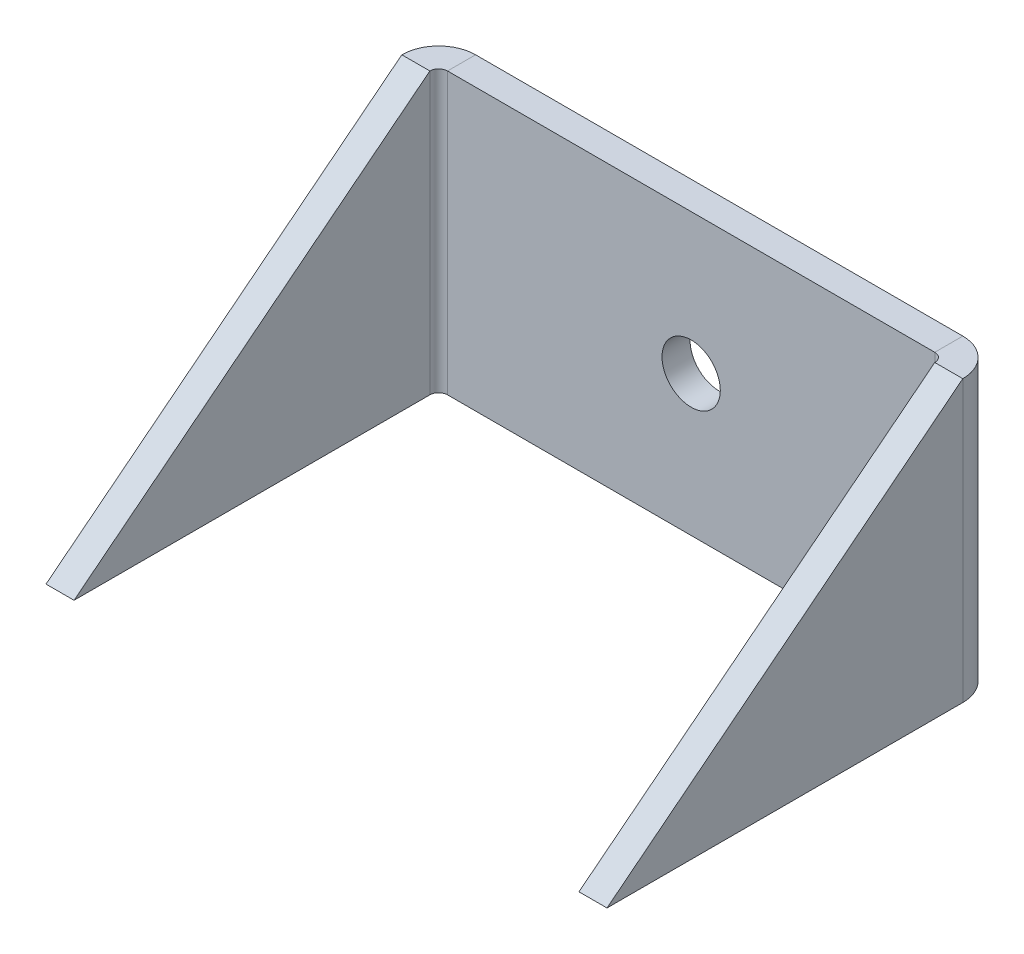
from build123d import *

# Parameters (mm, degrees)
SKETCH2_W                    = 57.15
SKETCH2_H                    = 31.75
BASE_FLANGE1_DEPTH           = 3.175
EDGE_FLANGE1_STRIP_W         = 14.7
EDGE_FLANGE1_STRIP_H         = 3.175
EDGE_FLANGE1_STRIP_CUT_DEPTH = 31.75
EDGE_FLANGE1_DEPTH           = 31.75
CUT_EXTRUDE1_DEPTH           = 3.175
M6_CLEARANCE_HOLE1_D         = 6.6


# Sheet-metal steps are written as plain solids
with BuildPart() as part:
    # Sketch2 → Base-Flange1 (new body)
    with BuildSketch(Plane.XY):
        Rectangle(SKETCH2_W, SKETCH2_H)
    extrude(amount=BASE_FLANGE1_DEPTH)

    # Edge-Flange1 strip (across the edge) → Edge-Flange1 strip cut (cut)
    with BuildSketch(Plane(origin=(28.575, -15.875, 3.175), x_dir=(-1, 0, 0), z_dir=(0, 1, 0))):
        with Locations((-6.35, -1.5875)):
            Rectangle(EDGE_FLANGE1_STRIP_W, EDGE_FLANGE1_STRIP_H)
    edge_flange1_strip_cut = extrude(amount=EDGE_FLANGE1_STRIP_CUT_DEPTH, mode=Mode.SUBTRACT)

    # Edge-Flange1 section (across the edge) → Edge-Flange1 (add)
    with BuildSketch(Plane(origin=(28.575, -15.875, 3.175), x_dir=(-1, 0, 0), z_dir=(0, 1, 0))):
        with BuildLine():
            Line((-3.175, 1), (-3.175, 41.275))
            Line((-3.175, 41.275), (0, 41.275))
            Line((0, 41.275), (0, 1))
            ThreePointArc((0, 1), (0.292893219, 0.292893219), (1, 0))
            Line((1, 0), (1, -3.175))
            ThreePointArc((1, -3.175), (-1.952170811, -1.952170811), (-3.175, 1))
        make_face()
    edge_flange1 = extrude(amount=EDGE_FLANGE1_DEPTH)

    # Sketch10 → Cut-Extrude1 (cut)
    with BuildSketch(Plane(origin=(31.75, 0, 0), x_dir=(0, 0, -1), z_dir=(1, 0, 0))):
        Polygon((-4.175, 15.875), (-44.45, -15.875), (-44.45, 15.875), align=None)
    cut_extrude1 = extrude(amount=-CUT_EXTRUDE1_DEPTH, mode=Mode.SUBTRACT)

    # Mirror1: Edge-Flange1 strip cut, Edge-Flange1, Cut-Extrude1 across plane
    add(edge_flange1_strip_cut.mirror(Plane(origin=(0, 0, 0), x_dir=(0, 0, 1), z_dir=(1, 0, 0))), mode=Mode.SUBTRACT)
    add(edge_flange1.mirror(Plane(origin=(0, 0, 0), x_dir=(0, 0, 1), z_dir=(1, 0, 0))))
    add(cut_extrude1.mirror(Plane(origin=(0, 0, 0), x_dir=(0, 0, 1), z_dir=(1, 0, 0))), mode=Mode.SUBTRACT)

    # M6 Clearance Hole1 (through all)
    with Locations(Plane.XY.offset(3.175)):
        with Locations((0, 0)):
            Hole(M6_CLEARANCE_HOLE1_D / 2)


solid = part.part
